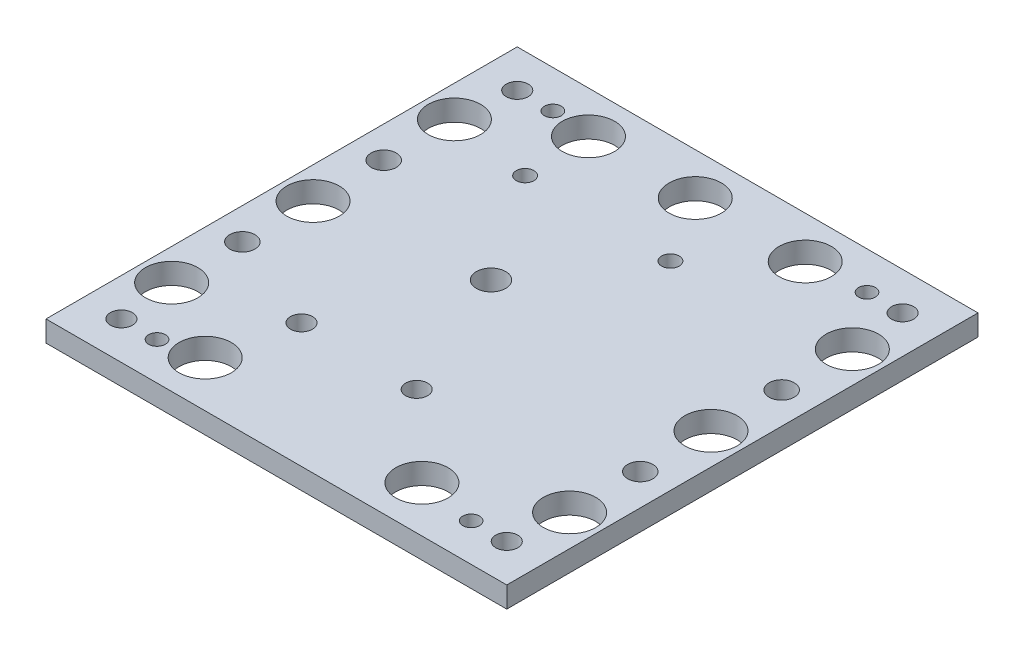
from build123d import *

# Parameters (mm, degrees)
SKETCH1_W                  = 220
SKETCH1_H                  = 225
BOSS_EXTRUDE1_DEPTH        = 10
CUT_EXTRUDE2_REACH         = 159.659
SKETCH3_R                  = 7
F_8_0MM_DOWEL_HOLE1_D      = 8
M10_CLEARANCE_HOLE1_D      = 10.5
M10_CLEARANCE_HOLE2_D      = 10.5
M8_CLEARANCE_HOLE1_D       = 8.4
CUT_EXTRUDE3_REACH         = 159.659
SKETCH17_R                 = 12.5
F_12_0_12_DIAMETER_HOLE1_D = 12


with BuildPart() as part:
    # Sketch1 → Boss-Extrude1 (new body)
    with BuildSketch(Plane(origin=(0, 0, 0), x_dir=(1, 0, 0), z_dir=(0, 1, 0))):
        Rectangle(SKETCH1_W, SKETCH1_H)
    extrude(amount=BOSS_EXTRUDE1_DEPTH)

    # Sketch3 → Cut-Extrude2 (cut, up to next)
    with BuildSketch(Plane.XZ, mode=Mode.PRIVATE) as cut_extrude2_sk1:
        with Locations((-19.87, -9.86)):
            Circle(SKETCH3_R)
    cut_extrude2_tool1 = extrude(cut_extrude2_sk1.sketch, amount=-CUT_EXTRUDE2_REACH, mode=Mode.PRIVATE) & part.part
    add(cut_extrude2_tool1.solids().sort_by_distance((-19.87, 0, -9.86))[0], mode=Mode.SUBTRACT)

    # Ø8.0mm Dowel Hole1 (through all)
    with Locations(Plane(origin=(0, 10, 0), x_dir=(1, 0, 0), z_dir=(0, 1, 0))):
        with Locations((75, -94.5), (-75, -94.5), (75, 94.5), (-75, 94.5)):
            Hole(F_8_0MM_DOWEL_HOLE1_D / 2)

    # M10 Clearance Hole1 (through all)
    with Locations(Plane(origin=(0, 10, 0), x_dir=(1, 0, 0), z_dir=(0, 1, 0))):
        with Locations((92, -94.5), (92, 94.5), (-92, 94.5), (-92, -94.5)):
            Hole(M10_CLEARANCE_HOLE1_D / 2)

    # M10 Clearance Hole2 (through all)
    with Locations(Plane(origin=(0, 10, 0), x_dir=(1, 0, 0), z_dir=(0, 1, 0))):
        with Locations((7.63, -53.14), (-47.37, -53.14)):
            Hole(M10_CLEARANCE_HOLE2_D / 2)

    # M8 Clearance Hole1 (through all)
    with Locations(Plane(origin=(0, 10, 0), x_dir=(1, 0, 0), z_dir=(0, 1, 0))):
        with Locations((15.13, 60.5), (-54.87, 61.13)):
            Hole(M8_CLEARANCE_HOLE1_D / 2)

    # Sketch17 → Cut-Extrude3 (cut, up to next)
    with BuildSketch(Plane(origin=(0, 10, 0), x_dir=(1, 0, 0), z_dir=(0, 1, 0)), mode=Mode.PRIVATE) as cut_extrude3_sk1:
        with Locations((-95, -67.5)):
            Circle(SKETCH17_R)
    cut_extrude3_tool1 = extrude(cut_extrude3_sk1.sketch, amount=-CUT_EXTRUDE3_REACH, mode=Mode.PRIVATE) & part.part
    # Sketch17 → Cut-Extrude3 (cut, up to next)
    with BuildSketch(Plane(origin=(0, 10, 0), x_dir=(1, 0, 0), z_dir=(0, 1, 0)), mode=Mode.PRIVATE) as cut_extrude3_sk2:
        with Locations((-95, 0)):
            Circle(SKETCH17_R)
    cut_extrude3_tool2 = extrude(cut_extrude3_sk2.sketch, amount=-CUT_EXTRUDE3_REACH, mode=Mode.PRIVATE) & part.part
    # Sketch17 → Cut-Extrude3 (cut, up to next)
    with BuildSketch(Plane(origin=(0, 10, 0), x_dir=(1, 0, 0), z_dir=(0, 1, 0)), mode=Mode.PRIVATE) as cut_extrude3_sk3:
        with Locations((-95, 67.5)):
            Circle(SKETCH17_R)
    cut_extrude3_tool3 = extrude(cut_extrude3_sk3.sketch, amount=-CUT_EXTRUDE3_REACH, mode=Mode.PRIVATE) & part.part
    # Sketch17 → Cut-Extrude3 (cut, up to next)
    with BuildSketch(Plane(origin=(0, 10, 0), x_dir=(1, 0, 0), z_dir=(0, 1, 0)), mode=Mode.PRIVATE) as cut_extrude3_sk4:
        with Locations((-56, -90.5)):
            Circle(SKETCH17_R)
    cut_extrude3_tool4 = extrude(cut_extrude3_sk4.sketch, amount=-CUT_EXTRUDE3_REACH, mode=Mode.PRIVATE) & part.part
    # Sketch17 → Cut-Extrude3 (cut, up to next)
    with BuildSketch(Plane(origin=(0, 10, 0), x_dir=(1, 0, 0), z_dir=(0, 1, 0)), mode=Mode.PRIVATE) as cut_extrude3_sk5:
        with Locations((47.5, -90.5)):
            Circle(SKETCH17_R)
    cut_extrude3_tool5 = extrude(cut_extrude3_sk5.sketch, amount=-CUT_EXTRUDE3_REACH, mode=Mode.PRIVATE) & part.part
    # Sketch17 → Cut-Extrude3 (cut, up to next)
    with BuildSketch(Plane(origin=(0, 10, 0), x_dir=(1, 0, 0), z_dir=(0, 1, 0)), mode=Mode.PRIVATE) as cut_extrude3_sk6:
        with Locations((95, -67.5)):
            Circle(SKETCH17_R)
    cut_extrude3_tool6 = extrude(cut_extrude3_sk6.sketch, amount=-CUT_EXTRUDE3_REACH, mode=Mode.PRIVATE) & part.part
    # Sketch17 → Cut-Extrude3 (cut, up to next)
    with BuildSketch(Plane(origin=(0, 10, 0), x_dir=(1, 0, 0), z_dir=(0, 1, 0)), mode=Mode.PRIVATE) as cut_extrude3_sk7:
        with Locations((95, 0)):
            Circle(SKETCH17_R)
    cut_extrude3_tool7 = extrude(cut_extrude3_sk7.sketch, amount=-CUT_EXTRUDE3_REACH, mode=Mode.PRIVATE) & part.part
    # Sketch17 → Cut-Extrude3 (cut, up to next)
    with BuildSketch(Plane(origin=(0, 10, 0), x_dir=(1, 0, 0), z_dir=(0, 1, 0)), mode=Mode.PRIVATE) as cut_extrude3_sk8:
        with Locations((95, 67.5)):
            Circle(SKETCH17_R)
    cut_extrude3_tool8 = extrude(cut_extrude3_sk8.sketch, amount=-CUT_EXTRUDE3_REACH, mode=Mode.PRIVATE) & part.part
    # Sketch17 → Cut-Extrude3 (cut, up to next)
    with BuildSketch(Plane(origin=(0, 10, 0), x_dir=(1, 0, 0), z_dir=(0, 1, 0)), mode=Mode.PRIVATE) as cut_extrude3_sk9:
        with Locations((47.5, 92.5)):
            Circle(SKETCH17_R)
    cut_extrude3_tool9 = extrude(cut_extrude3_sk9.sketch, amount=-CUT_EXTRUDE3_REACH, mode=Mode.PRIVATE) & part.part
    # Sketch17 → Cut-Extrude3 (cut, up to next)
    with BuildSketch(Plane(origin=(0, 10, 0), x_dir=(1, 0, 0), z_dir=(0, 1, 0)), mode=Mode.PRIVATE) as cut_extrude3_sk10:
        with Locations((-5, 92.5)):
            Circle(SKETCH17_R)
    cut_extrude3_tool10 = extrude(cut_extrude3_sk10.sketch, amount=-CUT_EXTRUDE3_REACH, mode=Mode.PRIVATE) & part.part
    # Sketch17 → Cut-Extrude3 (cut, up to next)
    with BuildSketch(Plane(origin=(0, 10, 0), x_dir=(1, 0, 0), z_dir=(0, 1, 0)), mode=Mode.PRIVATE) as cut_extrude3_sk11:
        with Locations((-56, 92.5)):
            Circle(SKETCH17_R)
    cut_extrude3_tool11 = extrude(cut_extrude3_sk11.sketch, amount=-CUT_EXTRUDE3_REACH, mode=Mode.PRIVATE) & part.part
    add(cut_extrude3_tool1.solids().sort_by_distance((-95, 10, 67.5))[0], mode=Mode.SUBTRACT)
    add(cut_extrude3_tool2.solids().sort_by_distance((-95, 10, 0))[0], mode=Mode.SUBTRACT)
    add(cut_extrude3_tool3.solids().sort_by_distance((-95, 10, -67.5))[0], mode=Mode.SUBTRACT)
    add(cut_extrude3_tool4.solids().sort_by_distance((-56, 10, 90.5))[0], mode=Mode.SUBTRACT)
    add(cut_extrude3_tool5.solids().sort_by_distance((47.5, 10, 90.5))[0], mode=Mode.SUBTRACT)
    add(cut_extrude3_tool6.solids().sort_by_distance((95, 10, 67.5))[0], mode=Mode.SUBTRACT)
    add(cut_extrude3_tool7.solids().sort_by_distance((95, 10, 0))[0], mode=Mode.SUBTRACT)
    add(cut_extrude3_tool8.solids().sort_by_distance((95, 10, -67.5))[0], mode=Mode.SUBTRACT)
    add(cut_extrude3_tool9.solids().sort_by_distance((47.5, 10, -92.5))[0], mode=Mode.SUBTRACT)
    add(cut_extrude3_tool10.solids().sort_by_distance((-5, 10, -92.5))[0], mode=Mode.SUBTRACT)
    add(cut_extrude3_tool11.solids().sort_by_distance((-56, 10, -92.5))[0], mode=Mode.SUBTRACT)

    # Ø12.0 (12) Diameter Hole1 (through all)
    with Locations(Plane(origin=(0, 10, 0), x_dir=(1, 0, 0), z_dir=(0, 1, 0))):
        with Locations((95, -33.75), (-95, -33.75), (-95, 33.75), (95, 33.75)):
            Hole(F_12_0_12_DIAMETER_HOLE1_D / 2)


solid = part.part
